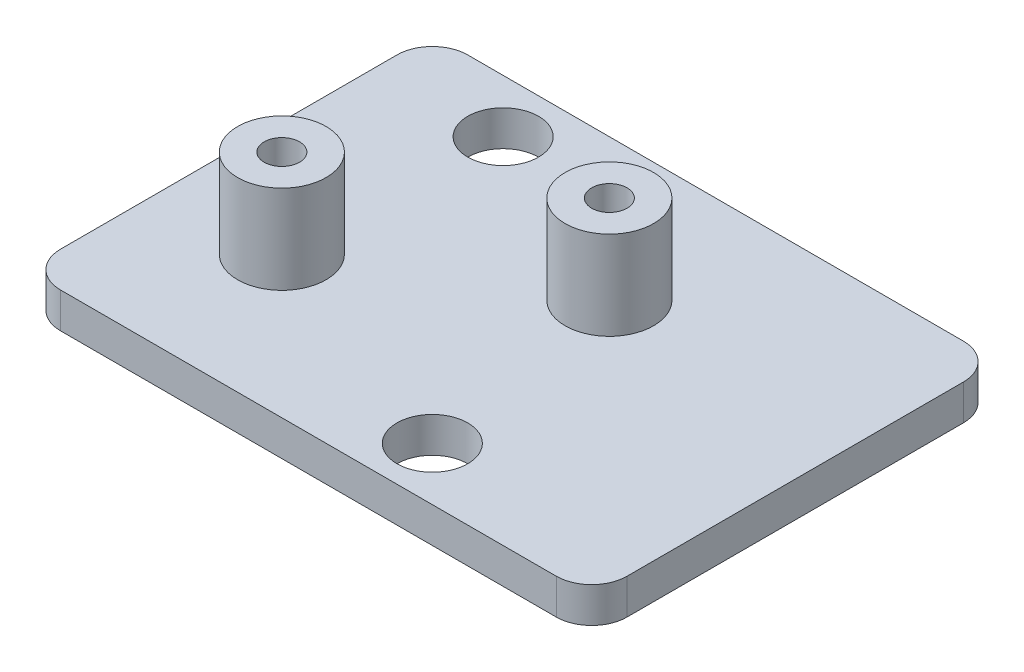
from build123d import *

# Parameters (mm, degrees)
SKETCH_1_W          = 32
SKETCH_1_H          = 23
EXTRUDE_1_DEPTH     = 2
SKETCH_4_R          = 2.5
EXTRUDE_2_DEPTH     = 5
SKETCH_5_R          = 1
CUT_EXTRUDE_1_DEPTH = 41.024992192
SKETCH_7_R          = 2
CUT_EXTRUDE_2_DEPTH = 40.724048132
FILLET_1_R          = 2
FILLET_2_R          = 2
FILLET_3_R          = 2
FILLET_4_R          = 2


with BuildPart() as part:
    # Эскиз1 → Бобышка-Вытянуть1 (new body)
    with BuildSketch(Plane(origin=(0, 0, 0), x_dir=(1, 0, 0), z_dir=(0, 1, 0))):
        with Locations((16, -11.5)):
            Rectangle(SKETCH_1_W, SKETCH_1_H)
    extrude(amount=EXTRUDE_1_DEPTH)

    # Эскиз4 → Бобышка-Вытянуть2 (add)
    with BuildSketch(Plane(origin=(0, 2, 0), x_dir=(1, 0, 0), z_dir=(0, 1, 0))):
        with Locations((18, -8)):
            Circle(SKETCH_4_R)
        with Locations((6.5, -15)):
            Circle(SKETCH_4_R)
    extrude(amount=EXTRUDE_2_DEPTH)

    # Эскиз5 → Вырез-Вытянуть1 (cut, through all)
    with BuildSketch(Plane(origin=(0, 7, 0), x_dir=(1, 0, 0), z_dir=(0, 1, 0))):
        with Locations((6.5, -15)):
            Circle(SKETCH_5_R)
        with Locations((18, -8)):
            Circle(SKETCH_5_R)
    extrude(amount=-CUT_EXTRUDE_1_DEPTH, mode=Mode.SUBTRACT)

    # Эскиз7 → Вырез-Вытянуть2 (cut, through all)
    with BuildSketch(Plane(origin=(0, 2, 0), x_dir=(1, 0, 0), z_dir=(0, 1, 0))):
        with Locations((7, -3)):
            Circle(SKETCH_7_R)
        with Locations((20, -20)):
            Circle(SKETCH_7_R)
    extrude(amount=-CUT_EXTRUDE_2_DEPTH, mode=Mode.SUBTRACT)

    # Скругление1
    fillet_1_edges = [part.edges().sort_by_distance(p)[0] for p in [
        (0, 1, 0),
    ]]
    fillet(fillet_1_edges, radius=FILLET_1_R)

    # Скругление2
    fillet_2_edges = [part.edges().sort_by_distance(p)[0] for p in [
        (0, 1, 23),
    ]]
    fillet(fillet_2_edges, radius=FILLET_2_R)

    # Скругление3
    fillet_3_edges = [part.edges().sort_by_distance(p)[0] for p in [
        (32, 1, 23),
    ]]
    fillet(fillet_3_edges, radius=FILLET_3_R)

    # Скругление4
    fillet_4_edges = [part.edges().sort_by_distance(p)[0] for p in [
        (32, 1, 0),
    ]]
    fillet(fillet_4_edges, radius=FILLET_4_R)


solid = part.part
